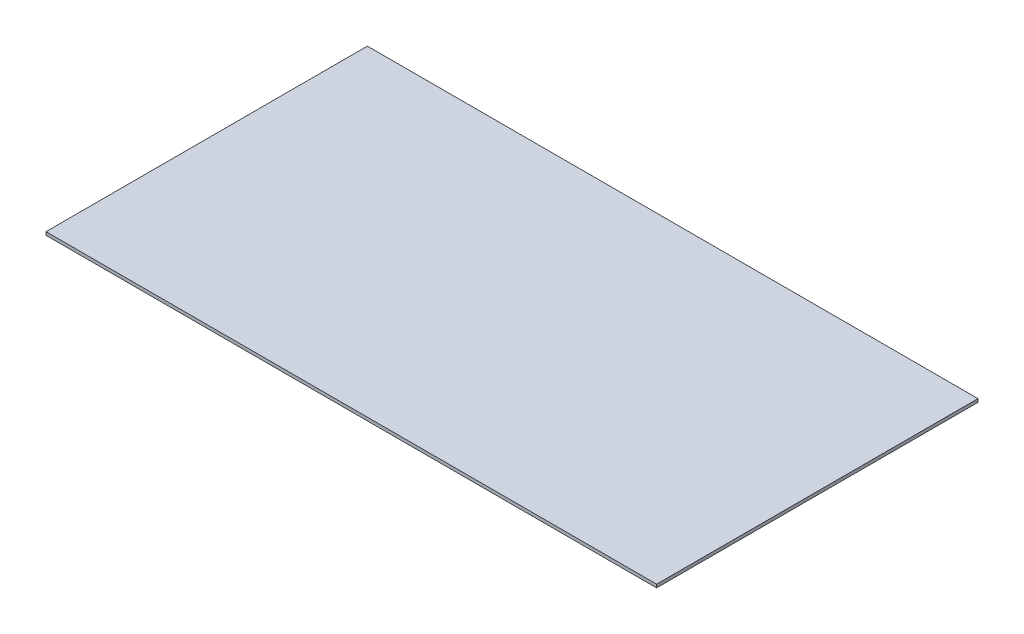
from build123d import *

# Parameters (mm, degrees)
SKETCH1_W               = 482.6
SKETCH1_H               = 254
WORK_AREA_19X10IN_DEPTH = 2.54


with BuildPart() as part:
    # Sketch1 → Work Area 19x10in (new body)
    with BuildSketch(Plane(origin=(0, 0, 0), x_dir=(1, 0, 0), z_dir=(0, 1, 0))):
        Rectangle(SKETCH1_W, SKETCH1_H)
    extrude(amount=WORK_AREA_19X10IN_DEPTH)


solid = part.part
